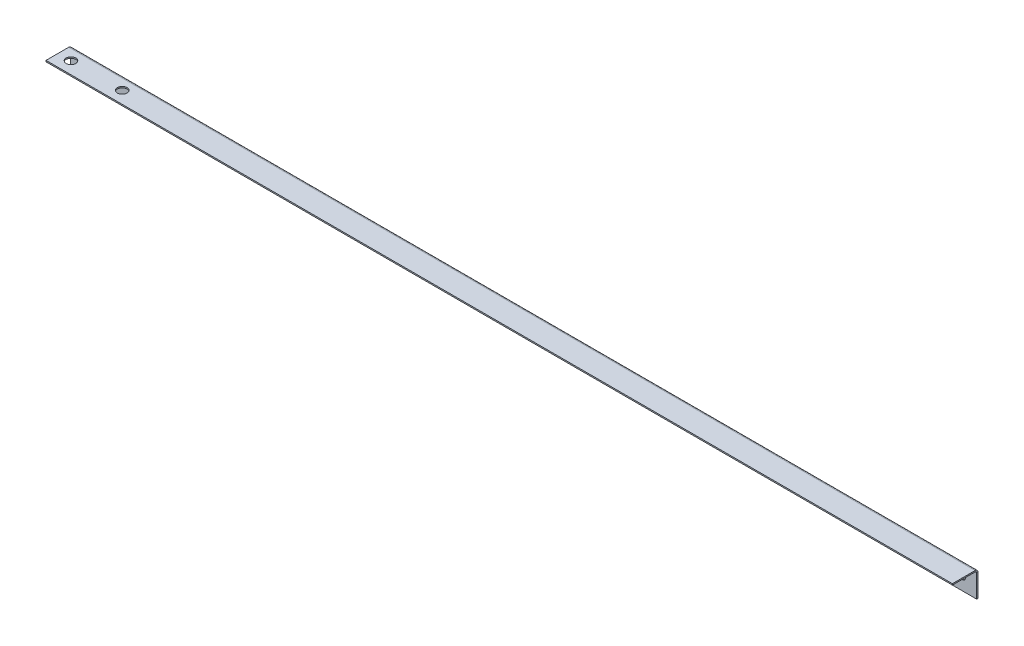
from build123d import *

# Parameters (mm, degrees)
SKETCH1_W                    = 1415
SKETCH1_H                    = 40
BASE_FLANGE1_DEPTH           = 2
EDGE_FLANGE1_STRIP_W         = 13
EDGE_FLANGE1_STRIP_H         = 2
EDGE_FLANGE1_STRIP_CUT_DEPTH = 1415
EDGE_FLANGE1_DEPTH           = 1415
SKETCH9_R                    = 7.5
CUT_EXTRUDE1_DEPTH           = 920.516022359


# Sheet-metal steps are written as plain solids
with BuildPart() as part:
    # Sketch1 → Base-Flange1 (new body)
    with BuildSketch(Plane.XY):
        with Locations((-210.444287729, 62.85774027)):
            Rectangle(SKETCH1_W, SKETCH1_H)
        with BuildLine():
            Line((474.555712271, 57.85774027), (459.555712271, 57.85774027))
            ThreePointArc((459.555712271, 57.85774027), (454.555712271, 62.85774027), (459.555712271, 67.85774027))
            Line((459.555712271, 67.85774027), (474.555712271, 67.85774027))
            ThreePointArc((474.555712271, 67.85774027), (479.555712271, 62.85774027), (474.555712271, 57.85774027))
        make_face(mode=Mode.SUBTRACT)
        with BuildLine():
            Line((374.555712271, 57.85774027), (359.555712271, 57.85774027))
            ThreePointArc((359.555712271, 57.85774027), (354.555712271, 62.85774027), (359.555712271, 67.85774027))
            Line((359.555712271, 67.85774027), (374.555712271, 67.85774027))
            ThreePointArc((374.555712271, 67.85774027), (379.555712271, 62.85774027), (374.555712271, 57.85774027))
        make_face(mode=Mode.SUBTRACT)
    extrude(amount=-BASE_FLANGE1_DEPTH)

    # Edge-Flange1 strip (across the edge) → Edge-Flange1 strip cut (cut)
    with BuildSketch(Plane(origin=(497.055712271, 82.85774027, 0), x_dir=(0, -1, 0), z_dir=(-1, 0, 0))):
        with Locations((-2, -1)):
            Rectangle(EDGE_FLANGE1_STRIP_W, EDGE_FLANGE1_STRIP_H)
    extrude(amount=EDGE_FLANGE1_STRIP_CUT_DEPTH, mode=Mode.SUBTRACT)

    # Edge-Flange1 section (across the edge) → Edge-Flange1 (add)
    with BuildSketch(Plane(origin=(497.055712271, 82.85774027, 0), x_dir=(0, -1, 0), z_dir=(-1, 0, 0))):
        with BuildLine():
            Line((0, 2.5), (0, 38))
            Line((0, 38), (2, 38))
            Line((2, 38), (2, 2.5))
            ThreePointArc((2, 2.5), (2.732233047, 0.732233047), (4.5, 0))
            Line((4.5, 0), (4.5, -2))
            ThreePointArc((4.5, -2), (1.318019485, -0.681980515), (0, 2.5))
        make_face()
    extrude(amount=EDGE_FLANGE1_DEPTH)

    # Sketch9 → Cut-Extrude1 (cut, through all)
    with BuildSketch(Plane.XZ.offset(-80.85774027)):
        with Locations(Location((-897.944287729, 19, 0), (0, 0, 270))):
            Circle(SKETCH9_R)
        with Locations(Location((-817.944287729, 19, 0), (0, 0, 270))):
            Circle(SKETCH9_R)
    extrude(amount=-CUT_EXTRUDE1_DEPTH, mode=Mode.SUBTRACT)


solid = part.part
